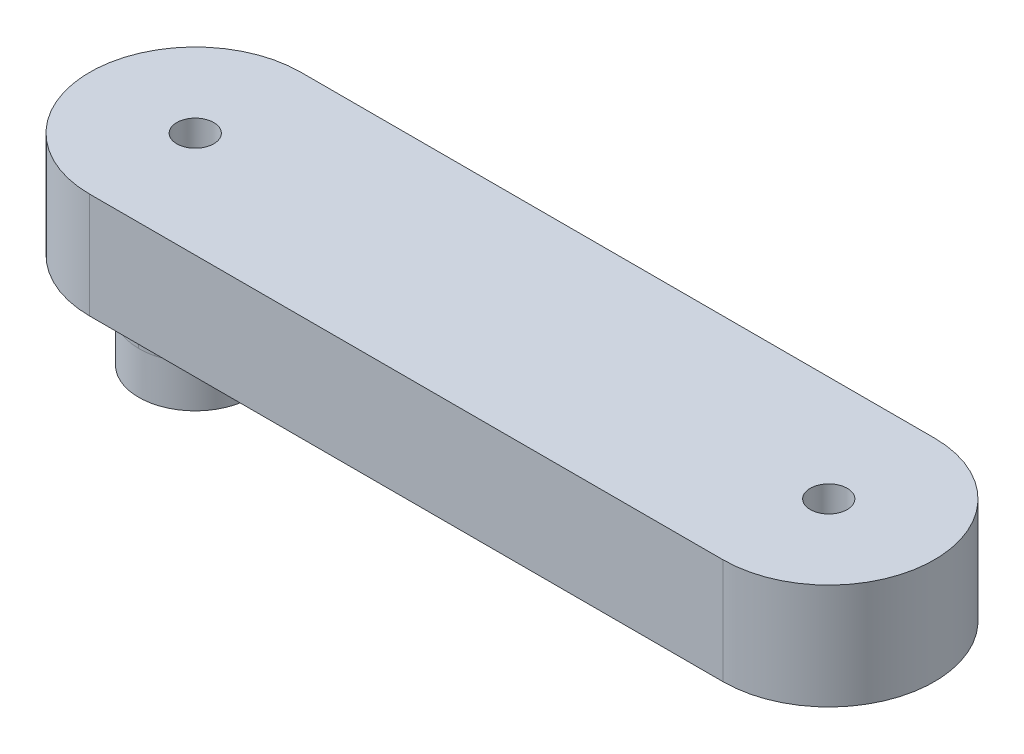
from build123d import *

# Parameters (mm, degrees)
BOSS_EXTRUDE1_DEPTH = 10
CUT_EXTRUDE1_REACH  = 44.426
SKETCH2_R           = 1.75
SKETCH5_R           = 5.35
BOSS_EXTRUDE3_DEPTH = 9
FILLET1_R           = 5
CUT_EXTRUDE2_REACH  = 47.398
SKETCH6_R           = 1.75


with BuildPart() as part:
    # Sketch1 → Boss-Extrude1 (new body)
    with BuildSketch(Plane(origin=(0, 0, 0), x_dir=(1, 0, 0), z_dir=(0, 1, 0))):
        with BuildLine():
            Line((-30, 10), (30, 10))
            ThreePointArc((30, 10), (40, 0), (30, -10))
            Line((30, -10), (-30, -10))
            ThreePointArc((-30, -10), (-40, 0), (-30, 10))
        make_face()
    extrude(amount=BOSS_EXTRUDE1_DEPTH)

    # Sketch2 → Cut-Extrude1 (cut, up to next)
    with BuildSketch(Plane(origin=(0, 10, 0), x_dir=(1, 0, 0), z_dir=(0, 1, 0)), mode=Mode.PRIVATE) as cut_extrude1_sk1:
        with Locations((30, 0)):
            Circle(SKETCH2_R)
    cut_extrude1_tool1 = extrude(cut_extrude1_sk1.sketch, amount=-CUT_EXTRUDE1_REACH, mode=Mode.PRIVATE) & part.part
    add(cut_extrude1_tool1.solids().sort_by_distance((30, 10, 0))[0], mode=Mode.SUBTRACT)

    # Sketch5 → Boss-Extrude3 (add)
    with BuildSketch(Plane.XZ):
        with Locations((-30, 0)):
            Circle(SKETCH5_R)
    extrude(amount=BOSS_EXTRUDE3_DEPTH)

    # Fillet1
    fillet1_edges = [part.edges().sort_by_distance(p)[0] for p in [
        (-35.35, 0, 0),
    ]]
    fillet(fillet1_edges, radius=FILLET1_R)

    # Sketch6 → Cut-Extrude2 (cut, up to next)
    with BuildSketch(Plane(origin=(0, -9, 0), x_dir=(-1, 0, 0), z_dir=(0, -1, 0)), mode=Mode.PRIVATE) as cut_extrude2_sk1:
        with Locations((30, 0)):
            Circle(SKETCH6_R)
    cut_extrude2_tool1 = extrude(cut_extrude2_sk1.sketch, amount=-CUT_EXTRUDE2_REACH, mode=Mode.PRIVATE) & part.part
    add(cut_extrude2_tool1.solids().sort_by_distance((-30, -9, 0))[0], mode=Mode.SUBTRACT)


solid = part.part
